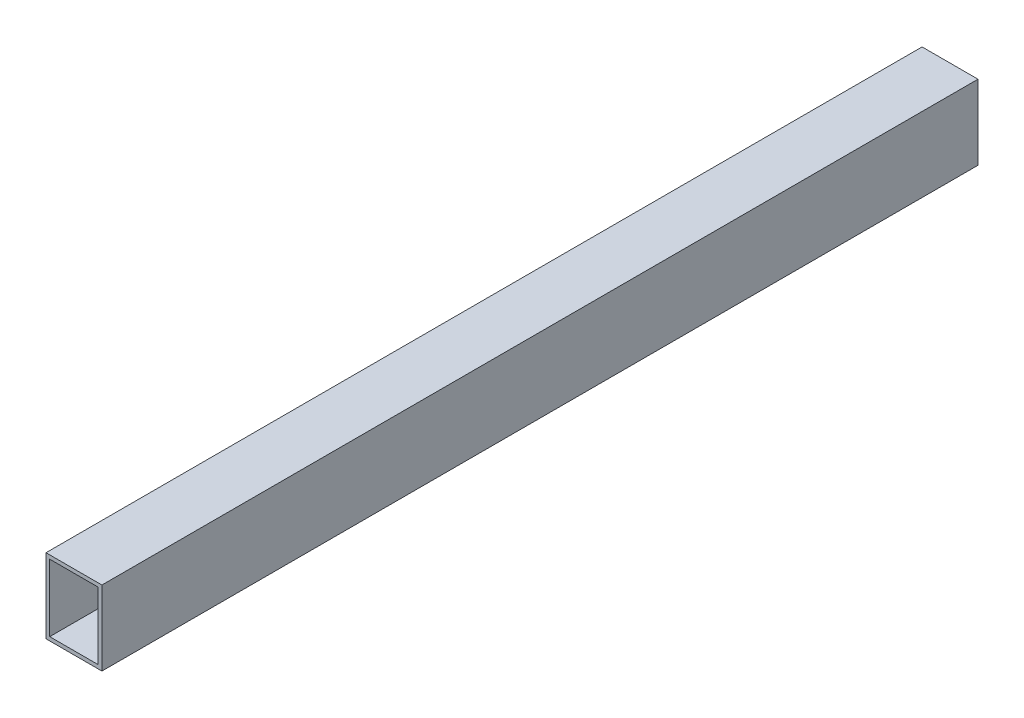
from build123d import *

# Parameters (mm, degrees)
SKETCH_1_W      = 15
SKETCH_1_H      = 20
SKETCH_1_W_2    = 13
SKETCH_1_H_2    = 18
EXTRUDE_1_DEPTH = 235


with BuildPart() as part:
    # 草图1 → 拉伸-薄壁1 (new body)
    with BuildSketch(Plane.XY):
        with Locations((7.5, -10)):
            Rectangle(SKETCH_1_W, SKETCH_1_H)
        with Locations((7.5, -10)):
            Rectangle(SKETCH_1_W_2, SKETCH_1_H_2, mode=Mode.SUBTRACT)
    extrude(amount=EXTRUDE_1_DEPTH)


solid = part.part
